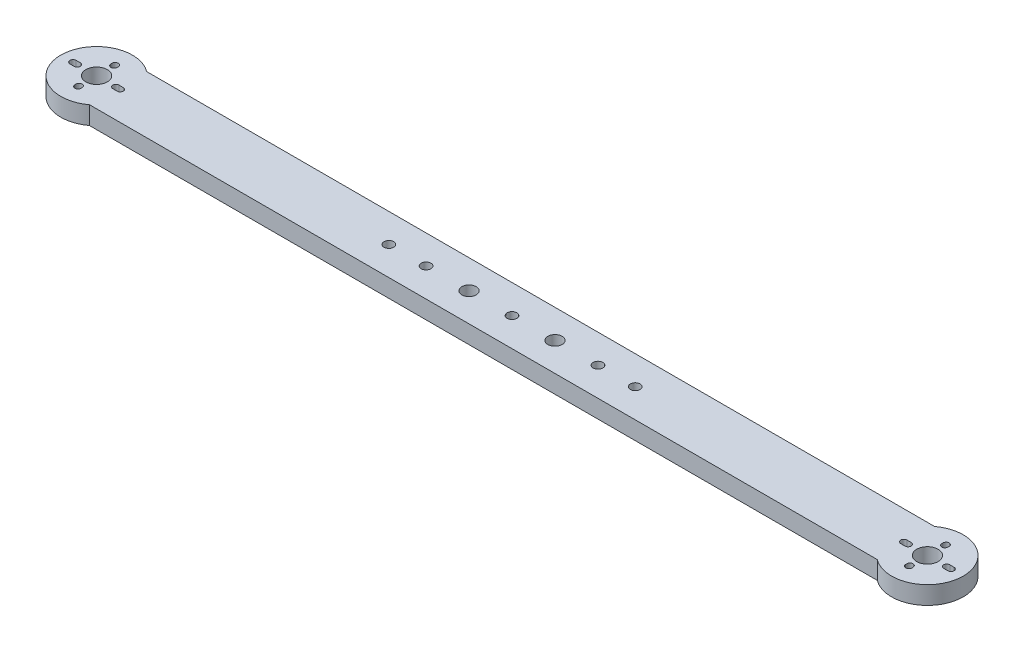
from build123d import *

# Parameters (mm, degrees)
BOSS_EXTRUDE1_DEPTH = 8
SKETCH2_R           = 4.75
CUT_EXTRUDE1_DEPTH  = 201.81338663
SKETCH3_R           = 2.159
CUT_EXTRUDE2_DEPTH  = 201.81338663
SKETCH4_R           = 3.175
CUT_EXTRUDE3_DEPTH  = 201.81338663
SKETCH5_R           = 2.159
CUT_EXTRUDE4_DEPTH  = 201.81338663


with BuildPart() as part:
    # Sketch1 → Boss-Extrude1 (new body)
    with BuildSketch(Plane(origin=(0, 0, 0), x_dir=(1, 0, 0), z_dir=(0, 1, 0))):
        with BuildLine():
            Line((-174.625, 12.7), (174.625, 12.7))
            ThreePointArc((174.625, 12.7), (200.025, 0), (174.625, -12.7))
            Line((174.625, -12.7), (-174.625, -12.7))
            ThreePointArc((-174.625, -12.7), (-200.025, 0), (-174.625, 12.7))
        make_face()
    extrude(amount=BOSS_EXTRUDE1_DEPTH)

    # Sketch2 → Cut-Extrude1 (cut, through all)
    with BuildSketch(Plane(origin=(0, 8, 0), x_dir=(1, 0, 0), z_dir=(0, 1, 0))):
        with Locations((184.15, 0)):
            Circle(SKETCH2_R)
        with Locations((-184.15, 0)):
            Circle(SKETCH2_R)
        with BuildLine():
            Line((173.691383345, 1.375), (175.608616655, 1.375))
            ThreePointArc((175.608616655, 1.375), (176.983616655, 0), (175.608616655, -1.375))
            Line((175.608616655, -1.375), (173.691383345, -1.375))
            ThreePointArc((173.691383345, -1.375), (172.316383345, 0), (173.691383345, 1.375))
        make_face()
        with BuildLine():
            Line((194.608616655, 1.375), (192.691383345, 1.375))
            ThreePointArc((192.691383345, 1.375), (191.316383345, 0), (192.691383345, -1.375))
            Line((192.691383345, -1.375), (194.608616655, -1.375))
            ThreePointArc((194.608616655, -1.375), (195.983616655, 0), (194.608616655, 1.375))
        make_face()
        with BuildLine():
            Line((185.525, 8.25), (185.525, 7.75))
            ThreePointArc((185.525, 7.75), (184.15, 6.375), (182.775, 7.75))
            Line((182.775, 7.75), (182.775, 8.25))
            ThreePointArc((182.775, 8.25), (184.15, 9.625), (185.525, 8.25))
        make_face()
        with BuildLine():
            Line((185.525, -8.25), (185.525, -7.75))
            ThreePointArc((185.525, -7.75), (184.15, -6.375), (182.775, -7.75))
            Line((182.775, -7.75), (182.775, -8.25))
            ThreePointArc((182.775, -8.25), (184.15, -9.625), (185.525, -8.25))
        make_face()
        with BuildLine():
            Line((-185.525, -8.25), (-185.525, -7.75))
            ThreePointArc((-185.525, -7.75), (-184.15, -6.375), (-182.775, -7.75))
            Line((-182.775, -7.75), (-182.775, -8.25))
            ThreePointArc((-182.775, -8.25), (-184.15, -9.625), (-185.525, -8.25))
        make_face()
        with BuildLine():
            Line((-185.525, 8.25), (-185.525, 7.75))
            ThreePointArc((-185.525, 7.75), (-184.15, 6.375), (-182.775, 7.75))
            Line((-182.775, 7.75), (-182.775, 8.25))
            ThreePointArc((-182.775, 8.25), (-184.15, 9.625), (-185.525, 8.25))
        make_face()
        with BuildLine():
            Line((-194.608616655, 1.375), (-192.691383345, 1.375))
            ThreePointArc((-192.691383345, 1.375), (-191.316383345, 0), (-192.691383345, -1.375))
            Line((-192.691383345, -1.375), (-194.608616655, -1.375))
            ThreePointArc((-194.608616655, -1.375), (-195.983616655, 0), (-194.608616655, 1.375))
        make_face()
        with BuildLine():
            Line((-173.691383345, 1.375), (-175.608616655, 1.375))
            ThreePointArc((-175.608616655, 1.375), (-176.983616655, 0), (-175.608616655, -1.375))
            Line((-175.608616655, -1.375), (-173.691383345, -1.375))
            ThreePointArc((-173.691383345, -1.375), (-172.316383345, 0), (-173.691383345, 1.375))
        make_face()
    extrude(amount=-CUT_EXTRUDE1_DEPTH, mode=Mode.SUBTRACT)

    # Sketch3 → Cut-Extrude2 (cut, through all)
    with BuildSketch(Plane(origin=(0, 8, 0), x_dir=(1, 0, 0), z_dir=(0, 1, 0))):
        Circle(SKETCH3_R)
        with Locations((38.1, 0)):
            Circle(SKETCH3_R)
        with Locations((-38.1, 0)):
            Circle(SKETCH3_R)
    extrude(amount=-CUT_EXTRUDE2_DEPTH, mode=Mode.SUBTRACT)

    # Sketch4 → Cut-Extrude3 (cut, through all)
    with BuildSketch(Plane(origin=(0, 8, 0), x_dir=(1, 0, 0), z_dir=(0, 1, 0))):
        with Locations((-19.05, 0)):
            Circle(SKETCH4_R)
        with Locations((19.05, 0)):
            Circle(SKETCH4_R)
    extrude(amount=-CUT_EXTRUDE3_DEPTH, mode=Mode.SUBTRACT)

    # Sketch5 → Cut-Extrude4 (cut, through all)
    with BuildSketch(Plane(origin=(0, 8, 0), x_dir=(1, 0, 0), z_dir=(0, 1, 0))):
        with Locations((54.61, 0)):
            Circle(SKETCH5_R)
        with Locations((-54.61, 0)):
            Circle(SKETCH5_R)
    extrude(amount=-CUT_EXTRUDE4_DEPTH, mode=Mode.SUBTRACT)


solid = part.part
